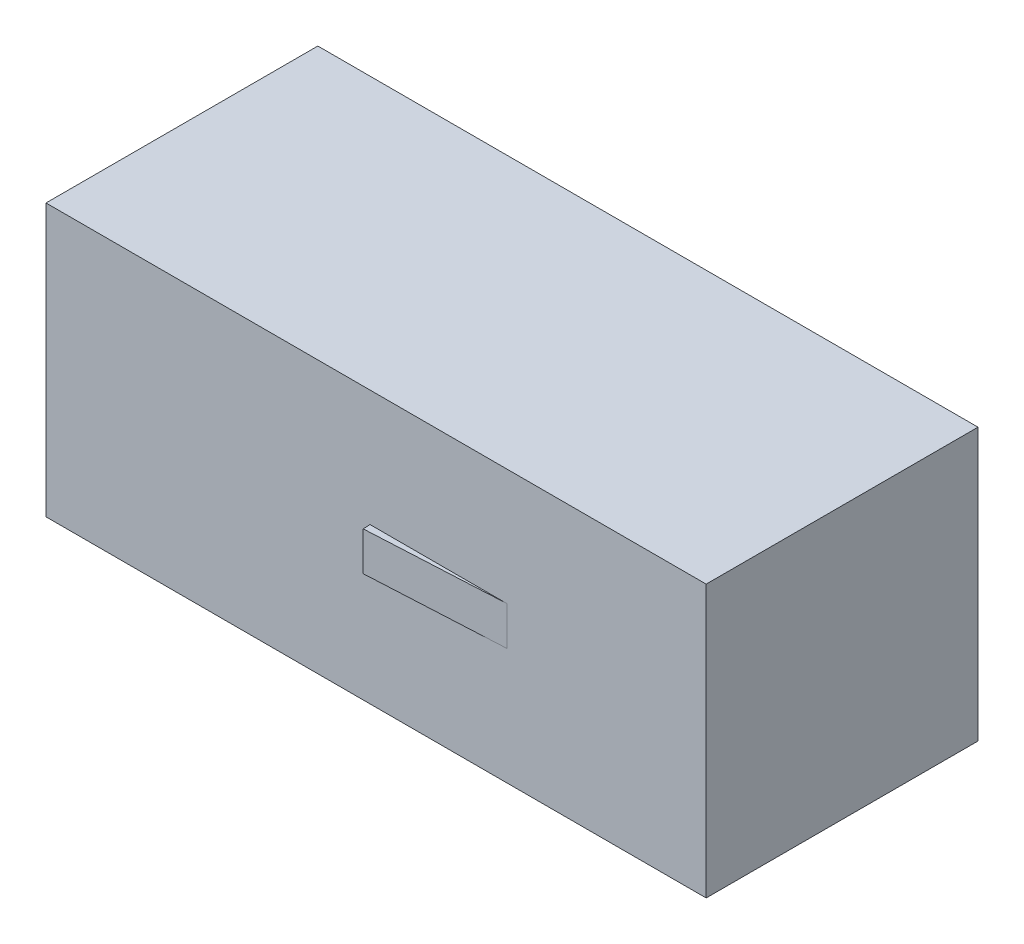
from build123d import *

# Parameters (mm, degrees)
SKETCH_1_W      = 170
SKETCH_1_H      = 70
EXTRUDE_1_DEPTH = 35
EXTRUDE_START   = -35
EXTRUDE_2_DEPTH = 5


with BuildPart() as part:
    # Эскиз1 → Бобышка-Вытянуть1 (new, symmetric)
    with BuildSketch(Plane.XY):
        Rectangle(SKETCH_1_W, SKETCH_1_H)
    extrude(amount=EXTRUDE_1_DEPTH, both=True)

    # Эскиз2 → Бобышка-Вытянуть2 (add, symmetric)
    with BuildSketch(Plane.XZ.offset(35).offset(EXTRUDE_START)):
        Polygon((33.713551402, 35), (-1.569013743, 35), (-1.472372951, 36.844016157), align=None)
    extrude(amount=EXTRUDE_2_DEPTH, both=True)


solid = part.part
